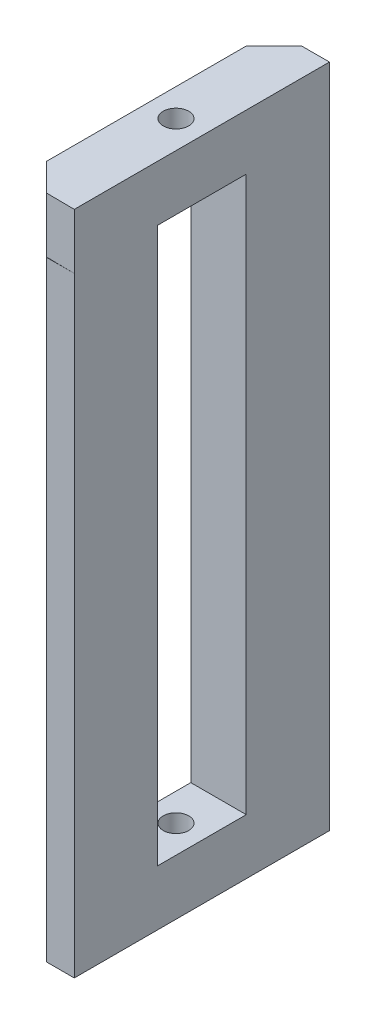
from build123d import *

# Parameters (mm, degrees)
SKETCH_1_R      = 2.3
EXTRUDE_1_DEPTH = 10
SKETCH_2_W      = 10
SKETCH_2_H      = 15
EXTRUDE_2_DEPTH = 100
SKETCH_3_R      = 2.3
EXTRUDE_3_DEPTH = 10
CHAMFER_1_SIZE  = 5


with BuildPart() as part:
    # Эскиз1 → Бобышка-Вытянуть1 (new body)
    with BuildSketch(Plane(origin=(0, 116.195974268, 0), x_dir=(1, 0, 0), z_dir=(0, 1, 0))):
        Polygon((-8.441019306, -97.523129836), (-8.441019306, -81.523129836), (-8.441019306, -66.523129836), (1.558980694, -66.523129836), (1.558980694, -112.523129836), (-8.441019306, -112.523129836), align=None)
        with Locations(Location((-3.441019306, -89.187817333, 0), (0, 0, 180))):
            Circle(SKETCH_1_R, mode=Mode.SUBTRACT)
    extrude(amount=EXTRUDE_1_DEPTH)

    # Эскиз2 → Бобышка-Вытянуть2 (add)
    with BuildSketch(Plane(origin=(0, 126.195974268, 0), x_dir=(1, 0, 0), z_dir=(0, 1, 0))):
        with Locations((-3.441019306, -74.023129836)):
            Rectangle(SKETCH_2_W, SKETCH_2_H)
        with Locations((-3.441019306, -105.023129836)):
            Rectangle(SKETCH_2_W, SKETCH_2_H)
    extrude(amount=EXTRUDE_2_DEPTH)

    # Эскиз3 → Бобышка-Вытянуть3 (add)
    with BuildSketch(Plane(origin=(0, 226.195974268, 0), x_dir=(1, 0, 0), z_dir=(0, 1, 0))):
        Polygon((-8.441019306, -66.543886748), (-8.441019306, -112.425486731), (1.558980694, -112.523129836), (1.558980694, -66.523129836), align=None)
        with Locations(Location((-3.441019306, -89.187817333, 0), (0, 0, 180))):
            Circle(SKETCH_3_R, mode=Mode.SUBTRACT)
    extrude(amount=EXTRUDE_3_DEPTH)

    # Фаска1
    # the kernel refuses this chamfer: 5 mm, written as the material it takes off along each edge
    with BuildSketch(Plane(origin=(-8.441019306, 239.054389208, 66.523129836), x_dir=(-0.027495876610586625, 0, 0.9996219169112968), z_dir=(0, -1, 0)), Plane(origin=(-8.441019306, 103.337559328, 112.523129836), x_dir=(-0.027495876610585935, 0, -0.9996219169112968), z_dir=(0, 1, 0))) as chamfer_1_piece_1:
        Polygon((CHAMFER_1_SIZE * 0.999621916911, -CHAMFER_1_SIZE * 0.0274958766106), (-CHAMFER_1_SIZE * 0.0274958766106, -CHAMFER_1_SIZE * 0.999621916911), (0, 0), align=None)
    extrude(amount=135.71682988, mode=Mode.SUBTRACT)


solid = part.part
